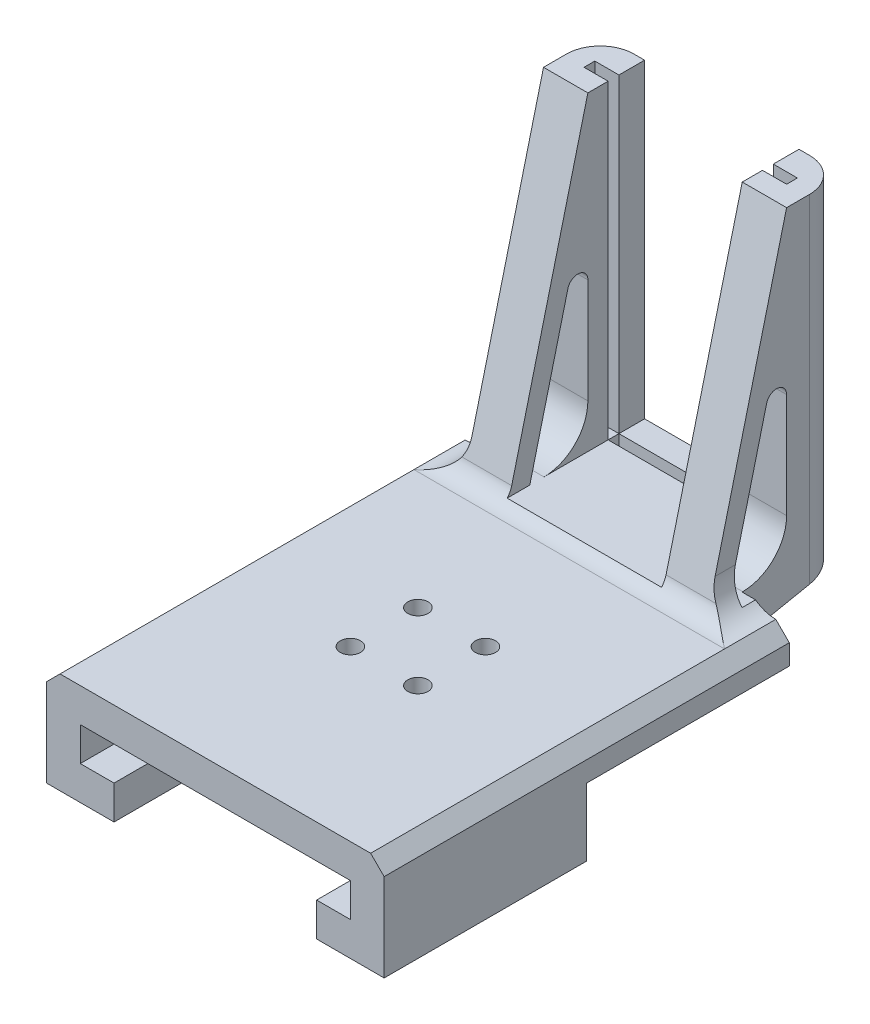
from build123d import *

# Parameters (mm, degrees)
SKETCH_2_W          = 60
SKETCH_2_H          = 60
EXTRUDE_1_DEPTH     = 3
SKETCH_3_R          = 1.5
CUT_EXTRUDE_1_DEPTH = 3
EXTRUDE_START       = 30
EXTRUDE_3_DEPTH     = 30
EXTRUDE_START_2     = 3
SKETCH_8_W          = 36
SKETCH_8_H          = 20
EXTRUDE_4_DEPTH     = 3
CUT_EXTRUDE_START   = 6
SKETCH_10_W         = 22.86
SKETCH_10_H         = 1.6
CUT_EXTRUDE_2_DEPTH = 3
EXTRUDE_START_3     = 6
EXTRUDE_5_DEPTH     = 46
EXTRUDE_START_4     = -18
EXTRUDE_6_DEPTH     = 36
EXTRUDE_START_5     = 18
EXTRUDE_8_DEPTH     = 6.57
EXTRUDE_START_6     = -11.43
EXTRUDE_9_DEPTH     = 6.57
EXTRUDE_10_DEPTH    = 36
SKETCH_16_W         = 5
SKETCH_16_H         = 60
CUT_EXTRUDE_3_DEPTH = 3
EXTRUDE_11_DEPTH    = 4
EXTRUDE_12_DEPTH    = 4
FILLET_3_R          = 5
FILLET_4_R          = 10
SKETCH_22_W         = 50
SKETCH_22_H         = 2
EXTRUDE_14_DEPTH    = 60
CUT_EXTRUDE_START_2 = 30
CUT_EXTRUDE_4_DEPTH = 60
SKETCH_25_R         = 1.5
CUT_EXTRUDE_5_DEPTH = 5
SKETCH_26_R         = 12.5
CUT_EXTRUDE_6_DEPTH = 2
FILLET_5_R          = 3
FILLET_7_R          = 5
FILLET_8_R          = 6.5
FILLET_9_R          = 1.5
FILLET_10_R         = 3


with BuildPart() as part:
    # 草图2 → 凸台-拉伸1 (new body)
    with BuildSketch(Plane(origin=(0, 0, 0), x_dir=(1, 0, 0), z_dir=(0, 1, 0))):
        Rectangle(SKETCH_2_W, SKETCH_2_H)
    extrude(amount=EXTRUDE_1_DEPTH)

    # 草图3 → 切除-拉伸1 (cut)
    with BuildSketch(Plane(origin=(0, 0, 0), x_dir=(1, 0, 0), z_dir=(0, 1, 0))):
        with Locations(Location((-5, -5, 0), (0, 0, 270))):
            Circle(SKETCH_3_R)
        with Locations(Location((5, -5, 0), (0, 0, 270))):
            Circle(SKETCH_3_R)
        with Locations(Location((5, 5, 0), (0, 0, 270))):
            Circle(SKETCH_3_R)
        with Locations(Location((-5, 5, 0), (0, 0, 270))):
            Circle(SKETCH_3_R)
    extrude(amount=CUT_EXTRUDE_1_DEPTH, mode=Mode.SUBTRACT)

    # 草图7 → 凸台-拉伸3 (add)
    with BuildSketch(Plane.XY.offset(EXTRUDE_START)):
        Polygon((-25, 0), (-25, -10), (-15, -10), (-15, -5), (-20, -5), (-20, 0), align=None)
        Polygon((20, 0), (25, 0), (25, -10), (15, -10), (15, -5), (20, -5), align=None)
    extrude(amount=-EXTRUDE_3_DEPTH)

    # 草图8 → 凸台-拉伸4 (add)
    with BuildSketch(Plane(origin=(0, 0, 0), x_dir=(1, 0, 0), z_dir=(0, 1, 0)).offset(EXTRUDE_START_2)):
        with Locations((0, 35)):
            Rectangle(SKETCH_8_W, SKETCH_8_H)
    extrude(amount=EXTRUDE_4_DEPTH)

    # 草图10 → 切除-拉伸2 (cut)
    with BuildSketch(Plane(origin=(0, 0, 0), x_dir=(1, 0, 0), z_dir=(0, 1, 0)).offset(CUT_EXTRUDE_START)):
        with Locations((0, 40.4)):
            Rectangle(SKETCH_10_W, SKETCH_10_H)
    extrude(amount=-CUT_EXTRUDE_2_DEPTH, mode=Mode.SUBTRACT)

    # 草图11 → 凸台-拉伸5 (add)
    with BuildSketch(Plane(origin=(0, 0, 0), x_dir=(1, 0, 0), z_dir=(0, 1, 0)).offset(EXTRUDE_START_3)):
        Polygon((11.43, 41.2), (11.43, 45), (18, 45), (18, 36.6), (11.43, 36.6), (11.43, 39.6), (15, 39.6), (15, 41.2), align=None)
        Polygon((-15, 41.2), (-15, 39.6), (-11.43, 39.6), (-11.43, 36.6), (-18, 36.6), (-18, 45), (-11.43, 45), (-11.43, 41.2), align=None)
    extrude(amount=EXTRUDE_5_DEPTH)

    # 草图12 → 凸台-拉伸6 (add)
    with BuildSketch(Plane(origin=(0, 0, 0), x_dir=(0, 0, -1), z_dir=(1, 0, 0)).offset(EXTRUDE_START_4)):
        Polygon((30, 0), (35, 3), (30, 3), align=None)
    extrude(amount=EXTRUDE_6_DEPTH)

    # 草图13 → 凸台-拉伸8 (add)
    with BuildSketch(Plane(origin=(0, 0, 0), x_dir=(0, 0, -1), z_dir=(1, 0, 0)).offset(EXTRUDE_START_5)):
        Polygon((25, 6), (36.6, 52), (36.6, 40.103448276), (28, 6), align=None)
    extrude(amount=-EXTRUDE_8_DEPTH)

    # 草图14 → 凸台-拉伸9 (add)
    with BuildSketch(Plane(origin=(0, 0, 0), x_dir=(0, 0, -1), z_dir=(1, 0, 0)).offset(EXTRUDE_START_6)):
        Polygon((36.6, 52), (25, 6), (28, 6), (36.6, 40.103448276), align=None)
    extrude(amount=-EXTRUDE_9_DEPTH)

    # 草图15 → 凸台-拉伸10 (add)
    with BuildSketch(Plane(origin=(0, 0, 0), x_dir=(0, 0, -1), z_dir=(1, 0, 0)).offset(EXTRUDE_START_4)):
        Polygon((25, 3), (24.243478261, 3), (25, 6), align=None)
    extrude(amount=EXTRUDE_10_DEPTH)

    # 草图16 → 切除-拉伸3 (cut)
    with BuildSketch(Plane(origin=(0, 0, 0), x_dir=(1, 0, 0), z_dir=(0, 1, 0))):
        with Locations((27.5, 0)):
            Rectangle(SKETCH_16_W, SKETCH_16_H)
        with Locations((-27.5, 0)):
            Rectangle(SKETCH_16_W, SKETCH_16_H)
    extrude(amount=CUT_EXTRUDE_3_DEPTH, mode=Mode.SUBTRACT)

    # 草图17 → 凸台-拉伸11 (add)
    with BuildSketch(Plane(origin=(0, 0, 0), x_dir=(0, 0, -1), z_dir=(1, 0, 0)).offset(EXTRUDE_START_5)):
        Polygon((30, 0), (45, 3), (30, 3), align=None)
    extrude(amount=-EXTRUDE_11_DEPTH)

    # 草图18 → 凸台-拉伸12 (add)
    with BuildSketch(Plane(origin=(0, 0, 0), x_dir=(0, 0, -1), z_dir=(1, 0, 0)).offset(EXTRUDE_START_4)):
        Polygon((30, 0), (30, 3), (45, 3), align=None)
    extrude(amount=EXTRUDE_12_DEPTH)

    # 圆角3
    # the kernel refuses this fillet: 5 mm, written as the material it takes off along each edge
    with BuildSketch(Plane(origin=(18, -9.5, -45), x_dir=(0, 0, 1), z_dir=(0, 1, 0)), Plane(origin=(-18, 64.5, -45), x_dir=(0, 0, 1), z_dir=(0, -1, 0))) as fillet_3_piece_1:
        with BuildLine():
            CenterArc((FILLET_3_R, -FILLET_3_R), FILLET_3_R, 90, 90)
            Line((0, -FILLET_3_R), (0, 0))
            Line((0, 0), (FILLET_3_R, 0))
        make_face()
    extrude(amount=74, mode=Mode.SUBTRACT)

    # 圆角4
    fillet_4_edges = [part.edges().sort_by_distance(p)[0] for p in [
        (0, 3, -35),
    ]]
    fillet(fillet_4_edges, radius=FILLET_4_R)

    # 草图22 → 凸台-拉伸14 (add)
    with BuildSketch(Plane.XY.offset(EXTRUDE_START)):
        with Locations((0, 4)):
            Rectangle(SKETCH_22_W, SKETCH_22_H)
    extrude(amount=-EXTRUDE_14_DEPTH)

    # 草图24 → 切除-拉伸4 (cut)
    with BuildSketch(Plane.XY.offset(CUT_EXTRUDE_START_2)):
        Polygon((-25, 5), (-23, 5), (-25, 3), align=None)
        Polygon((25, 5), (25, 3), (23, 5), align=None)
    extrude(amount=-CUT_EXTRUDE_4_DEPTH, mode=Mode.SUBTRACT)

    # 草图25 → 切除-拉伸5 (cut)
    with BuildSketch(Plane(origin=(0, 0, 0), x_dir=(1, 0, 0), z_dir=(0, 1, 0))):
        with Locations(Location((-5, 5, 0), (0, 0, 180))):
            Circle(SKETCH_25_R)
        with Locations(Location((5, 5, 0), (0, 0, 180))):
            Circle(SKETCH_25_R)
        with Locations(Location((5, -5, 0), (0, 0, 180))):
            Circle(SKETCH_25_R)
        with Locations(Location((-5, -5, 0), (0, 0, 180))):
            Circle(SKETCH_25_R)
    extrude(amount=CUT_EXTRUDE_5_DEPTH, mode=Mode.SUBTRACT)

    # 草图26 → 切除-拉伸6 (cut)
    with BuildSketch(Plane(origin=(0, 0, 0), x_dir=(1, 0, 0), z_dir=(0, 1, 0))):
        with Locations(Location((0, 0, 0), (0, 0, 270))):
            Circle(SKETCH_26_R)
    extrude(amount=CUT_EXTRUDE_6_DEPTH, mode=Mode.SUBTRACT)

    # 圆角5
    # the kernel refuses this fillet: 3 mm, written as the material it takes off along each edge
    with BuildSketch(Plane(origin=(0, 0, 0), x_dir=(0, 0, 1), z_dir=(-1, 0, 0))) as fillet_5_piece_1:
        with BuildLine():
            CenterArc((15.328427125, 3), FILLET_5_R, 199.471220634, 70.528779366)
            Line((15.328427125, 0), (15.328427125, -0.06))
            Line((15.328427125, -0.06), (12.5, -0.06))
            Line((12.5, -0.06), (12.44, 0))
            ThreePointArc((12.44, 0), (12.44, 1), (12.443431458, 1.98))
            Line((12.443431458, 1.98), (12.5, 2))
        make_face()
    revolve(axis=Axis((0, 0, 0), (0, 1, 0)), mode=Mode.SUBTRACT)

    # 圆角7
    # the kernel refuses this fillet: 5 mm, written as the material it adds along each edge
    with BuildSketch(Plane(origin=(-18, 5, -12.247826087), x_dir=(0, 1, 0), z_dir=(0, 0, -1))) as fillet_7_piece_1_section:
        with BuildLine():
            CenterArc((FILLET_7_R, -FILLET_7_R), FILLET_7_R, 90, 90)
            Line((0, -FILLET_7_R), (0, 0))
            Line((0, 0), (FILLET_7_R, 0))
        make_face()
    fillet_7_piece_1 = extrude(amount=30.252173913, mode=Mode.PRIVATE)
    fillet_7_piece_1 = split(fillet_7_piece_1, bisect_by=Plane(origin=(-18.571810287, 7.311264389, -25.330666672), z_dir=(0, -0.24451904524274018, -0.9696444897556934)), keep=Keep.TOP, mode=Mode.PRIVATE)
    fillet_7_piece_1 = split(fillet_7_piece_1, bisect_by=Plane(origin=(-18.571810287, 6.599974755, -28.151297982), z_dir=(0, 0.24451904524274015, 0.9696444897556934)), keep=Keep.TOP, mode=Mode.PRIVATE)
    add(fillet_7_piece_1)
    with BuildSketch(Plane(origin=(-18, 5, -12.247826087), x_dir=(0, 1, 0), z_dir=(0, 0, -1))) as fillet_7_piece_2_section:
        with BuildLine():
            CenterArc((FILLET_7_R, -FILLET_7_R), FILLET_7_R, 90, 90)
            Line((0, -FILLET_7_R), (0, 0))
            Line((0, 0), (FILLET_7_R, 0))
        make_face()
    fillet_7_piece_2 = extrude(amount=17.752173913, mode=Mode.PRIVATE)
    fillet_7_piece_2 = split(fillet_7_piece_2, bisect_by=Plane(origin=(-19.572975188, 6, -28.927333211), z_dir=(0, -1, 0)), keep=Keep.TOP, mode=Mode.PRIVATE)
    fillet_7_piece_2 = split(fillet_7_piece_2, bisect_by=Plane(origin=(-19.572975188, 5.678002788, -27.918800703), z_dir=(0, -0.24451904524274015, -0.9696444897556934)), keep=Keep.TOP, mode=Mode.PRIVATE)
    add(fillet_7_piece_2)
    with BuildSketch(Plane(origin=(18, 5, -30), x_dir=(1, 0, 0), z_dir=(0, 0, 1))) as fillet_7_piece_3_section:
        with BuildLine():
            CenterArc((FILLET_7_R, FILLET_7_R), FILLET_7_R, 180, 90)
            Line((0, FILLET_7_R), (0, 0))
            Line((0, 0), (FILLET_7_R, 0))
        make_face()
    fillet_7_piece_3 = extrude(amount=17.752173913, mode=Mode.PRIVATE)
    fillet_7_piece_3 = split(fillet_7_piece_3, bisect_by=Plane(origin=(19.572975189, 6, -28.92733321), z_dir=(0, -1, 0)), keep=Keep.TOP, mode=Mode.PRIVATE)
    fillet_7_piece_3 = split(fillet_7_piece_3, bisect_by=Plane(origin=(19.572975189, 6.389292423, -25.098169394), z_dir=(0, -0.24451904524274018, -0.9696444897556934)), keep=Keep.TOP, mode=Mode.PRIVATE)
    add(fillet_7_piece_3)
    with BuildSketch(Plane(origin=(18, 5, -42.5), x_dir=(1, 0, 0), z_dir=(0, 0, 1))) as fillet_7_piece_4_section:
        with BuildLine():
            CenterArc((FILLET_7_R, FILLET_7_R), FILLET_7_R, 180, 90)
            Line((0, FILLET_7_R), (0, 0))
            Line((0, 0), (FILLET_7_R, 0))
        make_face()
    fillet_7_piece_4 = extrude(amount=30.252173913, mode=Mode.PRIVATE)
    fillet_7_piece_4 = split(fillet_7_piece_4, bisect_by=Plane(origin=(18.571810287, 7.311264389, -25.330666672), z_dir=(0, -0.24451904524274018, -0.9696444897556934)), keep=Keep.TOP, mode=Mode.PRIVATE)
    fillet_7_piece_4 = split(fillet_7_piece_4, bisect_by=Plane(origin=(18.571810287, 6.599974754, -28.151297982), z_dir=(0, 0.24451904524274015, 0.9696444897556934)), keep=Keep.TOP, mode=Mode.PRIVATE)
    add(fillet_7_piece_4)

    # 圆角8
    fillet_8_edges = [part.edges().sort_by_distance(p)[0] for p in [
        (-14.715, 6, -36.6),
        (14.715, 6, -36.6),
    ]]
    fillet(fillet_8_edges, radius=FILLET_8_R)

    # 圆角9
    fillet_9_edges = [part.edges().sort_by_distance(p)[0] for p in [
        (14.715, 40.103448276, -36.6),
        (-14.715, 40.103448276, -36.6),
    ]]
    fillet(fillet_9_edges, radius=FILLET_9_R)

    # 圆角10
    # the kernel refuses this fillet: 3 mm, written as the material it adds along each edge
    with BuildSketch(Plane(origin=(-28.843489259, 5, -24.747826087), x_dir=(-2.8138525512499648e-15, 0.9696444897556498, -0.24451904524291254), z_dir=(1, 0, 0))) as fillet_10_piece_1_section:
        with BuildLine():
            CenterArc((FILLET_10_R * 0.779131901165, FILLET_10_R), FILLET_10_R, 194.153412588, 75.846587412)
            Line((-FILLET_10_R * 0.190512588591, FILLET_10_R * 0.755480954757), (0, 0))
            Line((0, 0), (FILLET_10_R * 0.779131901165, 0))
        make_face()
    fillet_10_piece_1 = extrude(amount=57.686978517, mode=Mode.PRIVATE)
    fillet_10_piece_1 = split(fillet_10_piece_1, bisect_by=Plane(origin=(-16.50607505, 6, -24.188979992), z_dir=(0, -1, 0)), keep=Keep.TOP, mode=Mode.PRIVATE)
    fillet_10_piece_1 = fillet_10_piece_1 - Plane(origin=(-23, 10, -24.188979992), x_dir=(0, 1, 0), z_dir=(0, 0, 1)) * Cylinder(5, 125, mode=Mode.PRIVATE)
    fillet_10_piece_1 = split(fillet_10_piece_1, bisect_by=Plane(origin=(-11.43, 5.296453609, -24.188979992), z_dir=(-1, 0, 0)), keep=Keep.TOP, mode=Mode.PRIVATE)
    fillet_10_piece_1 = split(fillet_10_piece_1, bisect_by=Plane(origin=(-19.60481072, 8.39518928, -24.188979992), z_dir=(0.7071067811865488, -0.7071067811865462, 0)), keep=Keep.TOP, mode=Mode.PRIVATE)
    add(fillet_10_piece_1)
    with BuildSketch(Plane(origin=(-28.843489259, 5, -24.747826087), x_dir=(-2.8138525512499648e-15, 0.9696444897556498, -0.24451904524291254), z_dir=(1, 0, 0))) as fillet_10_piece_2_section:
        with BuildLine():
            CenterArc((FILLET_10_R * 0.779131901165, FILLET_10_R), FILLET_10_R, 194.153412588, 75.846587412)
            Line((-FILLET_10_R * 0.190512588591, FILLET_10_R * 0.755480954757), (0, 0))
            Line((0, 0), (FILLET_10_R * 0.779131901165, 0))
        make_face()
    fillet_10_piece_2 = extrude(amount=57.686978517, mode=Mode.PRIVATE)
    fillet_10_piece_2 = split(fillet_10_piece_2, bisect_by=Plane(origin=(-15.490459674, 6, -25.045388179), z_dir=(0, 1, 0)), keep=Keep.TOP, mode=Mode.PRIVATE)
    fillet_10_piece_2 = fillet_10_piece_2 - Plane(origin=(-23, 10, -25.045388179), x_dir=(0, 1, 0), z_dir=(0, 0, 1)) * Cylinder(5, 125, mode=Mode.PRIVATE)
    fillet_10_piece_2 = split(fillet_10_piece_2, bisect_by=Plane(origin=(-11.43, 6.408777733, -25.045388179), z_dir=(-1, 0, 0)), keep=Keep.TOP, mode=Mode.PRIVATE)
    fillet_10_piece_2 = split(fillet_10_piece_2, bisect_by=Plane(origin=(-18.54084097, 9.45915903, -25.045388179), z_dir=(0.7071067811865488, -0.7071067811865462, 0)), keep=Keep.TOP, mode=Mode.PRIVATE)
    add(fillet_10_piece_2)
    with BuildSketch(Plane(origin=(-28.843489259, 5, -24.747826087), x_dir=(-2.8138525512499648e-15, 0.9696444897556498, -0.24451904524291254), z_dir=(1, 0, 0))) as fillet_10_piece_3_section:
        with BuildLine():
            CenterArc((FILLET_10_R * 0.779131901165, FILLET_10_R), FILLET_10_R, 194.153412588, 75.846587412)
            Line((-FILLET_10_R * 0.190512588591, FILLET_10_R * 0.755480954757), (0, 0))
            Line((0, 0), (FILLET_10_R * 0.779131901165, 0))
        make_face()
    fillet_10_piece_3 = extrude(amount=57.686978517, mode=Mode.PRIVATE)
    fillet_10_piece_3 = split(fillet_10_piece_3, bisect_by=Plane(origin=(0, 6, -24.222418931), z_dir=(0, -1, 0)), keep=Keep.TOP, mode=Mode.PRIVATE)
    fillet_10_piece_3 = split(fillet_10_piece_3, bisect_by=Plane(origin=(-11.43, 5.321349944, -24.222418931), z_dir=(1, 0, 0)), keep=Keep.TOP, mode=Mode.PRIVATE)
    fillet_10_piece_3 = split(fillet_10_piece_3, bisect_by=Plane(origin=(11.43, 5.321349944, -24.222418931), z_dir=(-1, 0, 0)), keep=Keep.TOP, mode=Mode.PRIVATE)
    add(fillet_10_piece_3)
    with BuildSketch(Plane(origin=(-28.843489259, 5, -24.747826087), x_dir=(-2.8138525512499648e-15, 0.9696444897556498, -0.24451904524291254), z_dir=(1, 0, 0))) as fillet_10_piece_4_section:
        with BuildLine():
            CenterArc((FILLET_10_R * 0.779131901165, FILLET_10_R), FILLET_10_R, 194.153412588, 75.846587412)
            Line((-FILLET_10_R * 0.190512588591, FILLET_10_R * 0.755480954757), (0, 0))
            Line((0, 0), (FILLET_10_R * 0.779131901165, 0))
        make_face()
    fillet_10_piece_4 = extrude(amount=57.686978517, mode=Mode.PRIVATE)
    fillet_10_piece_4 = split(fillet_10_piece_4, bisect_by=Plane(origin=(16.50607505, 6, -24.188979992), z_dir=(0, -1, 0)), keep=Keep.TOP, mode=Mode.PRIVATE)
    fillet_10_piece_4 = fillet_10_piece_4 - Plane(origin=(23, 10, -24.188979992), x_dir=(1, 0, 0), z_dir=(0, 0, -1)) * Cylinder(5, 125, mode=Mode.PRIVATE)
    fillet_10_piece_4 = split(fillet_10_piece_4, bisect_by=Plane(origin=(11.43, 5.296453609, -24.188979992), z_dir=(1, 0, 0)), keep=Keep.TOP, mode=Mode.PRIVATE)
    fillet_10_piece_4 = split(fillet_10_piece_4, bisect_by=Plane(origin=(19.60481072, 8.39518928, -24.188979992), z_dir=(-0.7071067811865306, -0.7071067811865644, 0)), keep=Keep.TOP, mode=Mode.PRIVATE)
    add(fillet_10_piece_4)
    with BuildSketch(Plane(origin=(-28.843489259, 5, -24.747826087), x_dir=(-2.8138525512499648e-15, 0.9696444897556498, -0.24451904524291254), z_dir=(1, 0, 0))) as fillet_10_piece_5_section:
        with BuildLine():
            CenterArc((FILLET_10_R * 0.779131901165, FILLET_10_R), FILLET_10_R, 194.153412588, 75.846587412)
            Line((-FILLET_10_R * 0.190512588591, FILLET_10_R * 0.755480954757), (0, 0))
            Line((0, 0), (FILLET_10_R * 0.779131901165, 0))
        make_face()
    fillet_10_piece_5 = extrude(amount=57.686978517, mode=Mode.PRIVATE)
    fillet_10_piece_5 = split(fillet_10_piece_5, bisect_by=Plane(origin=(15.490459674, 6, -25.045388179), z_dir=(0, 1, 0)), keep=Keep.TOP, mode=Mode.PRIVATE)
    fillet_10_piece_5 = fillet_10_piece_5 - Plane(origin=(23, 10, -25.045388179), x_dir=(1, 0, 0), z_dir=(0, 0, -1)) * Cylinder(5, 125, mode=Mode.PRIVATE)
    fillet_10_piece_5 = split(fillet_10_piece_5, bisect_by=Plane(origin=(11.43, 6.408777733, -25.045388179), z_dir=(1, 0, 0)), keep=Keep.TOP, mode=Mode.PRIVATE)
    fillet_10_piece_5 = split(fillet_10_piece_5, bisect_by=Plane(origin=(18.54084097, 9.45915903, -25.045388179), z_dir=(-0.7071067811865306, -0.7071067811865644, 0)), keep=Keep.TOP, mode=Mode.PRIVATE)
    add(fillet_10_piece_5)


solid = part.part
